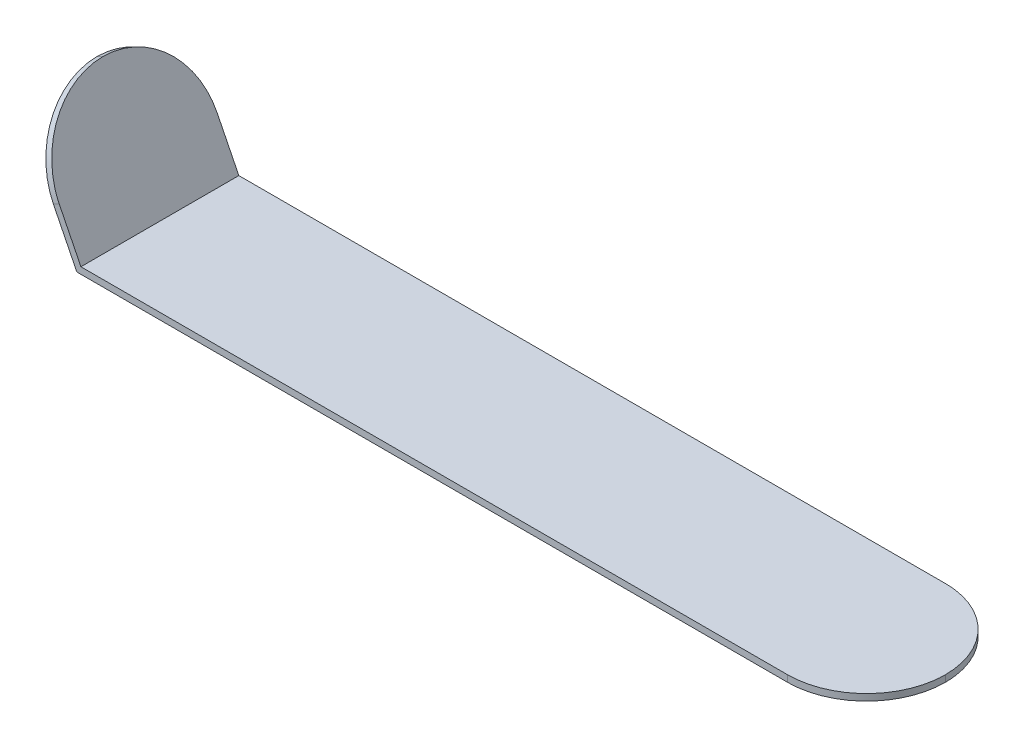
from build123d import *

# Parameters (mm, degrees)
RESSALTO_EXTRUS_O1_DEPTH = 12
FILETE1_START            = -1
FILETE1_DEPTH            = 5.566394674
FILETE1_2_DEPTH          = 0.5


with BuildPart() as part:
    # Esboço1 → Ressalto-extrusão1 (new body)
    with BuildSketch(Plane.XY):
        Polygon((0, 0), (60, 0), (60, 0.5), (0.309409388, 0.5), (-4.01451095, 9.172442523), (-4.461978131, 8.949343616), align=None)
    extrude(amount=RESSALTO_EXTRUS_O1_DEPTH)

    # Filete1: read off the stored shape, not the designer's step
    # Filete1 outline → Filete1 (cut)
    with BuildSketch(Plane(origin=(0, 0, 0), x_dir=(1, 0, 0), z_dir=(0, 1, 0)).offset(FILETE1_START)):
        with BuildLine():
            Line((60, -12), (60, -6))
            add(Edge.make_bspline(
                [(54, -12), (60, -12), (60, -6)],
                knots=[0, 0, 0, 1, 1, 1], degree=2, weights=[1, 0.707106781, 1]))
            Line((54, -12), (60, -12))
        make_face()
        with BuildLine():
            add(Edge.make_bspline(
                [(60, -6), (60, 0), (54, 0)],
                knots=[0, 0, 0, 1, 1, 1], degree=2, weights=[1, 0.707106781, 1]))
            Line((60, -6), (60, 0))
            Line((60, 0), (54, 0))
        make_face()
    extrude(amount=FILETE1_DEPTH, mode=Mode.SUBTRACT)

    # Filete1 2 outline → Filete1 2 (cut)
    with BuildSketch(Plane(origin=(0, 0, 0), x_dir=(0.44619781310978035, -0.8949343616020392, 0), z_dir=(0.8949343616020393, 0.44619781310977996, 0))):
        with BuildLine():
            Line((-10, 0), (-10, -6))
            add(Edge.make_bspline(
                [(-10, -6), (-10, 0), (-4, 0)],
                knots=[0, 0, 0, 1, 1, 1], degree=2, weights=[1, 0.707106781, 1]))
            Line((-4, 0), (-10, 0))
        make_face()
        with BuildLine():
            add(Edge.make_bspline(
                [(-4, -12), (-10, -12), (-10, -6)],
                knots=[0, 0, 0, 1, 1, 1], degree=2, weights=[1, 0.707106781, 1]))
            Line((-10, -6), (-10, -12))
            Line((-10, -12), (-4, -12))
        make_face()
    extrude(amount=FILETE1_2_DEPTH, mode=Mode.SUBTRACT)


solid = part.part
